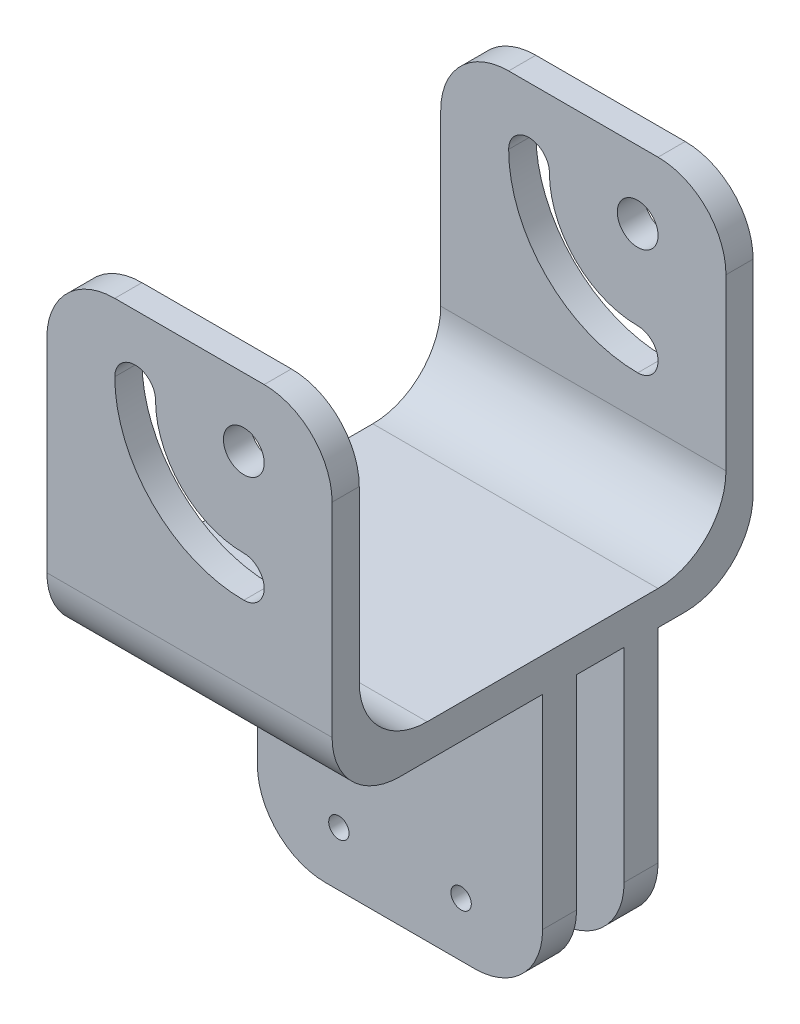
from build123d import *

# Parameters (mm, degrees)
ESBO_O1_W                = 42
ESBO_O1_H                = 50
ESBO_O1_R                = 3
RESSALTO_EXTRUS_O2_DEPTH = 62
ESBO_O3_W                = 42
ESBO_O3_H                = 54
CORTE_EXTRUS_O1_DEPTH    = 45
ESBO_O7_W                = 42
ESBO_O7_H                = 5
RESSALTO_EXTRUS_O3_DEPTH = 40
ESBO_O10_R               = 1.5
CORTE_EXTRUS_O2_DEPTH    = 82.043198357
FILETE1_R                = 10


with BuildPart() as part:
    # Esboço1 → Ressalto-extrusão2 (new body)
    with BuildSketch(Plane.XY):
        with Locations((21, 25)):
            Rectangle(ESBO_O1_W, ESBO_O1_H)
        with Locations((29, 40)):
            Circle(ESBO_O1_R, mode=Mode.SUBTRACT)
        with BuildLine():
            ThreePointArc((10, 40), (15.564971157, 26.564971157), (29, 21))
            ThreePointArc((29, 21), (32, 24), (29, 27))
            ThreePointArc((29, 27), (19.807611845, 30.807611845), (16, 40))
            ThreePointArc((16, 40), (13, 43), (10, 40))
        make_face(mode=Mode.SUBTRACT)
    extrude(amount=RESSALTO_EXTRUS_O2_DEPTH)

    # Esboço3 → Corte-extrusão1 (cut)
    with BuildSketch(Plane(origin=(0, 50, 0), x_dir=(1, 0, 0), z_dir=(0, 1, 0))):
        with Locations((21, -31)):
            Rectangle(ESBO_O3_W, ESBO_O3_H)
    extrude(amount=-CORTE_EXTRUS_O1_DEPTH, mode=Mode.SUBTRACT)

    # Esboço7 → Ressalto-extrusão3 (add)
    with BuildSketch(Plane.XZ):
        with Locations((21, 16.5)):
            Rectangle(ESBO_O7_W, ESBO_O7_H)
        with Locations((21, 28.5)):
            Rectangle(ESBO_O7_W, ESBO_O7_H)
    extrude(amount=RESSALTO_EXTRUS_O3_DEPTH)

    # Esboço10 → Corte-extrusão2 (cut, through all)
    with BuildSketch(Plane(origin=(0, 0, 14), x_dir=(-1, 0, 0), z_dir=(0, 0, -1))):
        with Locations((-30, -32)):
            Circle(ESBO_O10_R)
        with Locations((-12, -32)):
            Circle(ESBO_O10_R)
    extrude(amount=-CORTE_EXTRUS_O2_DEPTH, mode=Mode.SUBTRACT)

    # Filete1
    filete1_edges = [part.edges().sort_by_distance(p)[0] for p in [
        (21, 5, 4),
        (0, 50, 2),
        (42, 50, 2),
        (21, 5, 58),
        (21, 0, 62),
        (21, 0, 0),
        (42, -40, 28.5),
        (42, -40, 16.5),
        (0, -40, 16.5),
        (0, -40, 28.5),
        (0, 50, 60),
        (42, 50, 60),
    ]]
    fillet(filete1_edges, radius=FILETE1_R)


solid = part.part
